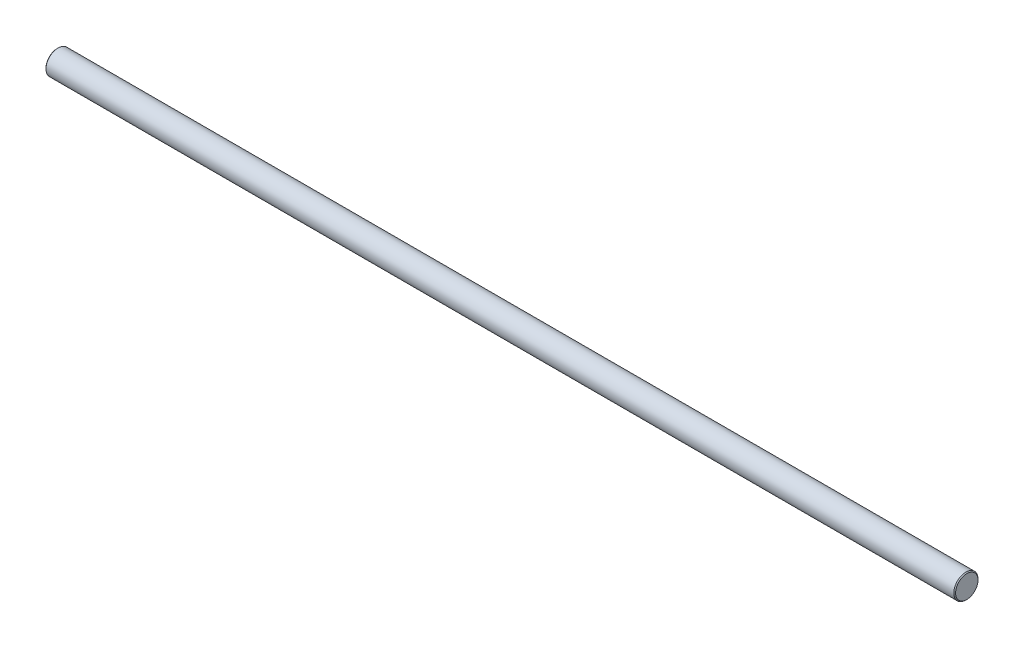
from build123d import *

# Parameters (mm, degrees)
SKETCH1_W     = 300
SKETCH1_H     = 4
CHAMFER1_SIZE = 0.3


with BuildPart() as part:
    # Sketch1 → Revolve1 (revolve)
    with BuildSketch(Plane.XY):
        with Locations((150, 2)):
            Rectangle(SKETCH1_W, SKETCH1_H)
    revolve(axis=Axis((0, 0, 0), (1, 0, 0)))

    # Chamfer1
    chamfer1_edges = [part.edges().sort_by_distance(p)[0] for p in [
        (300, -4, 0),
        (0, -4, 0),
    ]]
    chamfer(chamfer1_edges, length=CHAMFER1_SIZE)


solid = part.part
